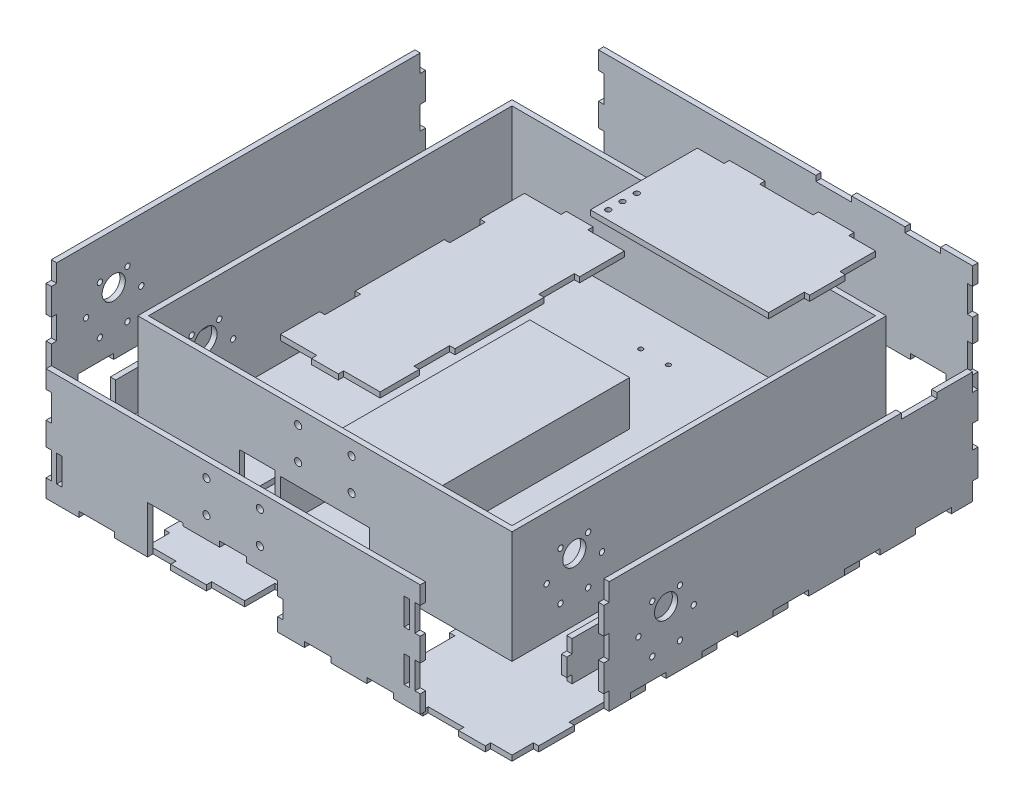
from build123d import *

# Parameters (mm, degrees)
SKETCH1_W             = 210
SKETCH1_H             = 210
BOSS_EXTRUDE1_DEPTH   = 63
SKETCH3_W             = 50
SKETCH3_H             = 25
CUT_EXTRUDE14_DEPTH   = 140
SHELL1_T              = -3
SKETCH5_R             = 6.5
CUT_EXTRUDE8_DEPTH    = 207
SKETCH5_3_R           = 6.5
SKETCH5_3_R_2         = 1.5
CUT_EXTRUDE9_DEPTH    = 3
CIRPATTERN1_START     = -105
CIRPATTERN1_OUTLINE_R = 1.5
CIRPATTERN1_DEPTH     = 3
SKETCH38_W            = 20
SKETCH38_H            = 26.5
CUT_EXTRUDE19_DEPTH   = 20
SKETCH19_R            = 1.25
CUT_EXTRUDE16_DEPTH   = 3
SKETCH21_R            = 2
CUT_EXTRUDE18_DEPTH   = 3
SKETCH22_R            = 2
SKETCH22_W            = 3
SKETCH22_H            = 15
BOSS_EXTRUDE2_DEPTH   = 1.5
SKETCH26_R            = 1.5
BOSS_EXTRUDE6_DEPTH   = 1.5
SKETCH23_R            = 1.5
SKETCH23_R_2          = 6.5
BOSS_EXTRUDE3_DEPTH   = 1.5
BOSS_EXTRUDE4_DEPTH   = 1.5
SKETCH25_R            = 1.25
BOSS_EXTRUDE5_DEPTH   = 1.5
SKETCH36_R            = 1.5
SKETCH36_R_2          = 6.5
BOSS_EXTRUDE7_DEPTH   = 1.5
BOSS_EXTRUDE8_DEPTH   = 1.5
BOSS_EXTRUDE9_DEPTH   = 3
BOSS_EXTRUDE10_DEPTH  = 3
BOSS_EXTRUDE11_DEPTH  = 3


# Read off the part's stored shape, not the designer's step: CirPattern1
with BuildPart() as part:
    # Sketch1 → Boss-Extrude1 (new body)
    with BuildSketch(Plane(origin=(0, 0, 0), x_dir=(1, 0, 0), z_dir=(0, 1, 0))):
        with Locations((0, 105)):
            Rectangle(SKETCH1_W, SKETCH1_H)
    extrude(amount=BOSS_EXTRUDE1_DEPTH)

    # Sketch3 → Cut-Extrude14 (cut)
    with BuildSketch(Plane.XY):
        with Locations((0, 12.5)):
            Rectangle(SKETCH3_W, SKETCH3_H)
    extrude(amount=-CUT_EXTRUDE14_DEPTH, mode=Mode.SUBTRACT)

    # Shell1
    shell1_openings = [part.faces().sort_by_distance(p)[0] for p in [
        (0, 63, -105),
    ]]
    offset(amount=SHELL1_T, openings=shell1_openings, kind=Kind.INTERSECTION)

    # Sketch5 → Cut-Extrude8 (cut)
    with BuildSketch(Plane.ZY.offset(105)):
        with Locations((-35, 35)):
            Circle(SKETCH5_R)
    cut_extrude8 = extrude(amount=-CUT_EXTRUDE8_DEPTH, mode=Mode.SUBTRACT)

    # Sketch5<3> → Cut-Extrude9 (cut)
    with BuildSketch(Plane.ZY.offset(105)):
        with Locations((-35, 35)):
            Circle(SKETCH5_3_R)
        with Locations(Location((-50.5, 28, 0), (0, 0, 180))):
            Circle(SKETCH5_3_R_2)
    cut_extrude9 = extrude(amount=-CUT_EXTRUDE9_DEPTH, mode=Mode.SUBTRACT)

    # CirPattern1 outline → CirPattern1 (cut)
    with BuildSketch(Plane.YZ.offset(CIRPATTERN1_START)):
        with Locations((14.576606241, -42.75)):
            Circle(CIRPATTERN1_OUTLINE_R)
        with Locations((14.576606241, -27.25)):
            Circle(CIRPATTERN1_OUTLINE_R)
        with Locations((28, -19.5)):
            Circle(CIRPATTERN1_OUTLINE_R)
        with Locations((41.423393759, -27.25)):
            Circle(CIRPATTERN1_OUTLINE_R)
        with Locations((41.423393759, -42.75)):
            Circle(CIRPATTERN1_OUTLINE_R)
    cirpattern1 = extrude(amount=CIRPATTERN1_DEPTH, mode=Mode.SUBTRACT)

    # Mirror2: Cut-Extrude8, Cut-Extrude9, CirPattern1 across plane
    add(cut_extrude8.mirror(Plane(origin=(0, 0, 0), x_dir=(0, 0, 1), z_dir=(1, 0, 0))), mode=Mode.SUBTRACT)
    add(cut_extrude9.mirror(Plane(origin=(0, 0, 0), x_dir=(0, 0, 1), z_dir=(1, 0, 0))), mode=Mode.SUBTRACT)
    add(cirpattern1.mirror(Plane(origin=(0, 0, 0), x_dir=(0, 0, 1), z_dir=(1, 0, 0))), mode=Mode.SUBTRACT)

    # Sketch38 → Cut-Extrude19 (cut)
    with BuildSketch(Plane.XY):
        with Locations((-38, 13.25)):
            Rectangle(SKETCH38_W, SKETCH38_H)
    extrude(amount=-CUT_EXTRUDE19_DEPTH, mode=Mode.SUBTRACT)

    # Sketch19 → Cut-Extrude16 (cut)
    with BuildSketch(Plane(origin=(0, 0, 0), x_dir=(-1, 0, 0), z_dir=(0, -1, 0))):
        with Locations(Location((-7.747, 185, 0), (0, 0, 90))):
            Circle(SKETCH19_R)
        with Locations(Location((7.747, 185, 0), (0, 0, 90))):
            Circle(SKETCH19_R)
    extrude(amount=-CUT_EXTRUDE16_DEPTH, mode=Mode.SUBTRACT)

    # Sketch21 → Cut-Extrude18 (cut)
    with BuildSketch(Plane.XY):
        with Locations((15, 54.88)):
            Circle(SKETCH21_R)
        with Locations((-15, 54.88)):
            Circle(SKETCH21_R)
        with Locations((-15, 36.88)):
            Circle(SKETCH21_R)
        with Locations((15, 36.88)):
            Circle(SKETCH21_R)
    extrude(amount=-CUT_EXTRUDE18_DEPTH, mode=Mode.SUBTRACT)


with BuildPart() as body_2:
    # Sketch22 → Boss-Extrude2 (new, symmetric)
    with BuildSketch(Plane.XY.offset(50)):
        Polygon((-105, 63), (-105, 53), (-102, 53), (-102, 38), (-105, 38), (-105, 25), (-102, 25), (-102, 10), (-105, 10), (-105, 0), (-86.5, 0), (-86.5, 3), (-66.5, 3), (-66.5, 0), (-48, 0), (-48, 26.5), (-28, 26.5), (-28, 25), (-25, 25), (-7.5, 25), (-7.5, 28), (7.5, 28), (7.5, 25), (25, 25), (25, 17.5), (28, 17.5), (28, 7.5), (25, 7.5), (25, 0), (40, 0), (40, 3), (55, 3), (55, 0), (75, 0), (75, 3), (90, 3), (90, 0), (105, 0), (105, 10), (102, 10), (102, 25), (105, 25), (105, 38), (102, 38), (102, 53), (105, 53), (105, 63), align=None)
        with Locations(Location((15, 54.88, 0), (0, 0, 180))):
            Circle(SKETCH22_R, mode=Mode.SUBTRACT)
        with Locations((-15, 36.88)):
            Circle(SKETCH22_R, mode=Mode.SUBTRACT)
        with Locations((-15, 54.88)):
            Circle(SKETCH22_R, mode=Mode.SUBTRACT)
        with Locations(Location((15, 36.88, 0), (0, 0, 180))):
            Circle(SKETCH22_R, mode=Mode.SUBTRACT)
        with Locations((97.5, 17.5)):
            Rectangle(SKETCH22_W, SKETCH22_H, mode=Mode.SUBTRACT)
        with Locations((97.5, 45.5)):
            Rectangle(SKETCH22_W, SKETCH22_H, mode=Mode.SUBTRACT)
        with Locations((-97.5, 17.5)):
            Rectangle(SKETCH22_W, SKETCH22_H, mode=Mode.SUBTRACT)
    extrude(amount=BOSS_EXTRUDE2_DEPTH, both=True)


with BuildPart() as body_3:
    # Sketch26 → Boss-Extrude6 (new, symmetric)
    with BuildSketch(Plane(origin=(0, 93, 0), x_dir=(1, 0, 0), z_dir=(0, 1, 0))):
        Polygon((102, 207), (87, 207), (87, 210), (67, 210), (67, 207), (37, 207), (37, 210), (17, 210), (17, 207), (2, 207), (2, 147), (102, 147), (102, 167), (105, 167), (105, 187), (102, 187), align=None)
        with Locations(Location((7, 152, 0), (0, 0, 270))):
            Circle(SKETCH26_R, mode=Mode.SUBTRACT)
        with Locations(Location((7, 160, 0), (0, 0, 270))):
            Circle(SKETCH26_R, mode=Mode.SUBTRACT)
        with Locations(Location((7, 168, 0), (0, 0, 270))):
            Circle(SKETCH26_R, mode=Mode.SUBTRACT)
    extrude(amount=BOSS_EXTRUDE6_DEPTH, both=True)


with BuildPart() as body_4:
    # Sketch23 → Boss-Extrude3 (new, symmetric)
    with BuildSketch(Plane(origin=(155, 0, 0), x_dir=(0, 0, -1), z_dir=(1, 0, 0))):
        Polygon((3, 63), (167, 63), (167, 60), (187, 60), (187, 63), (207, 63), (207, 53), (210, 53), (210, 38), (207, 38), (207, 25), (210, 25), (210, 10), (207, 10), (207, 0), (195, 0), (195, 3), (175, 3), (175, 0), (155, 0), (155, 3), (135, 3), (135, 0), (115, 0), (115, 3), (95, 3), (95, 0), (75, 0), (75, 3), (55, 3), (55, 0), (35, 0), (35, 3), (15, 3), (15, 0), (3, 0), (3, 10), (0, 10), (0, 25), (3, 25), (3, 38), (0, 38), (0, 53), (3, 53), align=None)
        with Locations((27.25, 14.576606241)):
            Circle(SKETCH23_R, mode=Mode.SUBTRACT)
        with Locations((42.75, 14.576606241)):
            Circle(SKETCH23_R, mode=Mode.SUBTRACT)
        with Locations((50.5, 28)):
            Circle(SKETCH23_R, mode=Mode.SUBTRACT)
        with Locations((19.5, 28)):
            Circle(SKETCH23_R, mode=Mode.SUBTRACT)
        with Locations((35, 35)):
            Circle(SKETCH23_R_2, mode=Mode.SUBTRACT)
        with Locations((42.75, 41.423393759)):
            Circle(SKETCH23_R, mode=Mode.SUBTRACT)
        with Locations((27.25, 41.423393759)):
            Circle(SKETCH23_R, mode=Mode.SUBTRACT)
    extrude(amount=BOSS_EXTRUDE3_DEPTH, both=True)


with BuildPart() as body_5:
    # Sketch24 → Boss-Extrude4 (new, symmetric)
    with BuildSketch(Plane.XY.offset(-260)):
        Polygon((105, 63), (87, 63), (87, 60), (67, 60), (67, 63), (37, 63), (37, 60), (17, 60), (17, 63), (-105, 63), (-105, 53), (-102, 53), (-102, 38), (-105, 38), (-105, 25), (-102, 25), (-102, 10), (-105, 10), (-105, 0), (-90, 0), (-90, 3), (-70, 3), (-70, 0), (-50, 0), (-50, 3), (-30, 3), (-30, 0), (-10, 0), (-10, 3), (10, 3), (10, 0), (30, 0), (30, 3), (50, 3), (50, 0), (70, 0), (70, 3), (90, 3), (90, 0), (105, 0), (105, 10), (102, 10), (102, 25), (105, 25), (105, 38), (102, 38), (102, 53), (105, 53), align=None)
    extrude(amount=BOSS_EXTRUDE4_DEPTH, both=True)


with BuildPart() as body_6:
    # Sketch25 → Boss-Extrude5 (new, symmetric)
    with BuildSketch(Plane(origin=(0, -50, 0), x_dir=(-1, 0, 0), z_dir=(0, -1, 0))):
        Polygon((25, 140), (7.5, 140), (7.5, 143), (-7.5, 143), (-7.5, 140), (-25, 140), (-25, 115), (-28, 115), (-28, 95), (-25, 95), (-25, 45), (-28, 45), (-28, 25), (-25, 25), (-25, 3), (-40, 3), (-40, 0), (-55, 0), (-55, 3), (-75, 3), (-75, 0), (-90, 0), (-90, 3), (-102, 3), (-102, 15), (-105, 15), (-105, 35), (-102, 35), (-102, 55), (-105, 55), (-105, 75), (-102, 75), (-102, 95), (-105, 95), (-105, 115), (-102, 115), (-102, 135), (-105, 135), (-105, 155), (-102, 155), (-102, 175), (-105, 175), (-105, 195), (-102, 195), (-102, 207), (-90, 207), (-90, 210), (-70, 210), (-70, 207), (-50, 207), (-50, 210), (-30, 210), (-30, 207), (-10, 207), (-10, 210), (10, 210), (10, 207), (30, 207), (30, 210), (50, 210), (50, 207), (70, 207), (70, 210), (90, 210), (90, 207), (102, 207), (102, 195), (105, 195), (105, 175), (102, 175), (102, 155), (105, 155), (105, 135), (102, 135), (102, 115), (105, 115), (105, 95), (102, 95), (102, 75), (105, 75), (105, 55), (102, 55), (102, 35), (105, 35), (105, 15), (102, 15), (102, 3), (86.5, 3), (86.5, 0), (66.5, 0), (66.5, 3), (48, 3), (48, 20), (25, 20), (25, 25), (28, 25), (28, 45), (25, 45), (25, 95), (28, 95), (28, 115), (25, 115), align=None)
        with Locations(Location((-7.747, 185, 0), (0, 0, 90))):
            Circle(SKETCH25_R, mode=Mode.SUBTRACT)
        with Locations(Location((7.747, 185, 0), (0, 0, 90))):
            Circle(SKETCH25_R, mode=Mode.SUBTRACT)
    extrude(amount=BOSS_EXTRUDE5_DEPTH, both=True)


with BuildPart() as body_7:
    # Sketch36 → Boss-Extrude7 (new, symmetric)
    with BuildSketch(Plane.ZY.offset(155)):
        Polygon((-207, 63), (-3, 63), (-3, 53), (0, 53), (0, 38), (-3, 38), (-3, 25), (0, 25), (0, 10), (-3, 10), (-3, 0), (-15, 0), (-15, 3), (-35, 3), (-35, 0), (-55, 0), (-55, 3), (-75, 3), (-75, 0), (-95, 0), (-95, 3), (-115, 3), (-115, 0), (-135, 0), (-135, 3), (-155, 3), (-155, 0), (-175, 0), (-175, 3), (-195, 3), (-195, 0), (-207, 0), (-207, 10), (-210, 10), (-210, 25), (-207, 25), (-207, 38), (-210, 38), (-210, 53), (-207, 53), align=None)
        with Locations((-27.25, 41.423393759)):
            Circle(SKETCH36_R, mode=Mode.SUBTRACT)
        with Locations((-42.75, 41.423393759)):
            Circle(SKETCH36_R, mode=Mode.SUBTRACT)
        with Locations((-35, 35)):
            Circle(SKETCH36_R_2, mode=Mode.SUBTRACT)
        with Locations((-19.5, 28)):
            Circle(SKETCH36_R, mode=Mode.SUBTRACT)
        with Locations((-50.5, 28)):
            Circle(SKETCH36_R, mode=Mode.SUBTRACT)
        with Locations((-42.75, 14.576606241)):
            Circle(SKETCH36_R, mode=Mode.SUBTRACT)
        with Locations((-27.25, 14.576606241)):
            Circle(SKETCH36_R, mode=Mode.SUBTRACT)
    extrude(amount=BOSS_EXTRUDE7_DEPTH, both=True)


with BuildPart() as body_8:
    # Sketch37 → Boss-Extrude8 (new, symmetric)
    with BuildSketch(Plane(origin=(134.239907326, 0, 0), x_dir=(0, 0, -1), z_dir=(1, 0, 0))):
        Polygon((95, 28), (115, 28), (115, 25), (140, 25), (140, 17.5), (143, 17.5), (143, 7.5), (140, 7.5), (140, 3), (115, 3), (115, 0), (95, 0), (95, 3), (45, 3), (45, 0), (25, 0), (25, 3), (3, 3), (3, 7.5), (0, 7.5), (0, 17.5), (3, 17.5), (3, 25), (25, 25), (25, 28), (45, 28), (45, 25), (95, 25), align=None)
    extrude(amount=BOSS_EXTRUDE8_DEPTH, both=True)


with BuildPart() as body_9:
    # Sketch39 → Boss-Extrude9 (new body)
    with BuildSketch(Plane.ZY.offset(118)):
        Polygon((-140.604067942, 25.000369823), (-115.604067942, 25.000369823), (-115.604067942, 28.000369823), (-95.604067942, 28.000369823), (-95.604067942, 25.000369823), (-45.604067942, 25.000369823), (-45.604067942, 28.000369823), (-25.604067942, 28.000369823), (-25.604067942, 25.000369823), (-0.604067942, 25.000369823), (-0.604067942, 3.000369823), (-25.604067942, 3.000369823), (-25.604067942, 0.000369823), (-45.604067942, 0.000369823), (-45.604067942, 3.000369823), (-95.651172119, 3), (-95.604067942, 0.000369823), (-115.604067942, 0.000369823), (-115.604067942, 3.000369823), (-140.604067942, 3.000369823), (-140.604067942, 7.500369823), (-143.604067942, 7.500369823), (-143.604067942, 17.500369823), (-140.604067942, 17.500369823), align=None)
    extrude(amount=BOSS_EXTRUDE9_DEPTH)


with BuildPart() as body_10:
    # Sketch40 → Boss-Extrude10 (new body)
    with BuildSketch(Plane(origin=(0, 0, -223), x_dir=(-1, 0, 0), z_dir=(0, 0, -1))):
        Polygon((0, 0), (7.5, 0), (7.5, 3), (24.5, 3), (27.5, 3), (27.5, 7.5), (24.5, 7.5), (24.5, 17.5), (27.5, 17.5), (27.5, 28), (24.5, 28), (7.5, 28), (7.5, 24.603003824), (-7.5, 24.603003824), (-7.5, 28), (-27.5, 28), (-27.5, 17.5), (-24.5, 17.5), (-24.5, 7.5), (-27.5, 7.5), (-27.5, 3), (-7.5, 3), (-7.5, 0), align=None)
    extrude(amount=BOSS_EXTRUDE10_DEPTH)


with BuildPart() as body_11:
    # Sketch42 → Boss-Extrude11 (new body)
    with BuildSketch(Plane(origin=(0, 88, 0), x_dir=(1, 0, 0), z_dir=(0, 1, 0))):
        Polygon((-7.5, 0), (-7.5, 3), (-28, 3), (-28, 25), (-25, 25), (-25, 45), (-28, 45), (-28, 95), (-25, 95), (-25, 115), (-28, 115), (-28, 140), (-7.5, 140), (-7.5, 143), (7.5, 143), (7.5, 140), (28, 140), (28, 115), (25, 115), (25, 95), (28, 95), (28, 45), (25, 45), (25, 25), (28, 25), (28, 3), (7.5, 3), (7.5, 0), align=None)
    extrude(amount=BOSS_EXTRUDE11_DEPTH)


solid = Compound([part.part, body_2.part, body_3.part, body_4.part, body_5.part, body_6.part, body_7.part, body_8.part, body_9.part, body_10.part, body_11.part])
